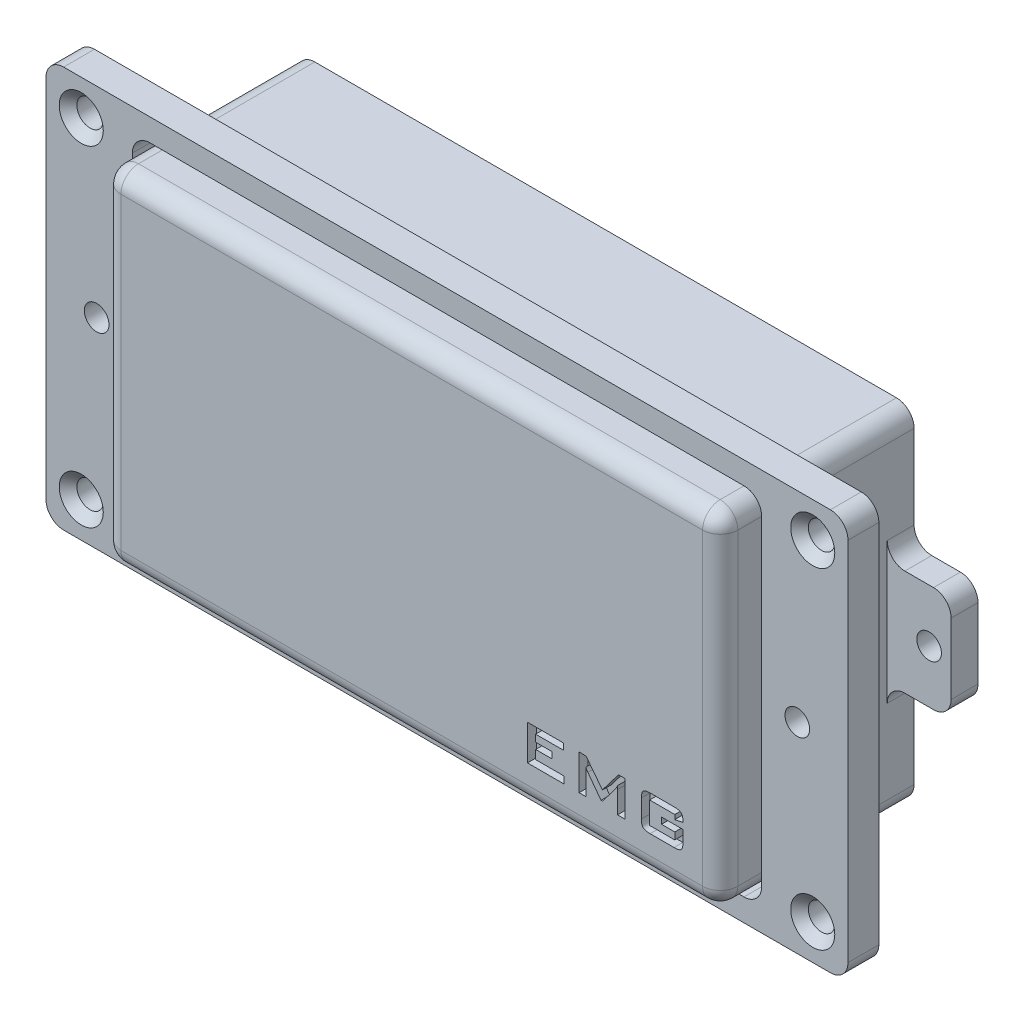
from build123d import *
from build123d.topology import SkipClean

# Parameters (mm, degrees)
SKETCH_1_W          = 70
SKETCH_1_H          = 39
EXTRUDE_1_DEPTH     = 22
SKETCH_2_R          = 1.4
EXTRUDE_2_DEPTH     = 3.05
SKETCH_3_W          = 91
SKETCH_3_H          = 45.5
EXTRUDE_3_DEPTH     = 7.5
SKETCH_4_W          = 91
SKETCH_4_H          = 45.5
SKETCH_4_W_2        = 71.4
SKETCH_4_H_2        = 40.4
CUT_EXTRUDE_1_DEPTH = 4
SKETCH_5_R          = 1.4
CUT_EXTRUDE_2_DEPTH = 64
SKETCH_6_R          = 1.5
CUT_EXTRUDE_3_DEPTH = 10
FILLET_1_R          = 2
FILLET_2_R          = 2
FILLET_3_R          = 2
CHAMFER_1_SIZE      = 1
CUT_EXTRUDE_4_DEPTH = 1
FILLET_4_R          = 2
SKETCH_8_W          = 66
SKETCH_8_H          = 35
CUT_EXTRUDE_5_DEPTH = 1
SKETCH_9_W          = 88
SKETCH_9_H          = 42.5
SKETCH_9_W_2        = 70.228427124
SKETCH_9_H_2        = 39.228427124
CUT_EXTRUDE_6_DEPTH = 1
SKETCH_11_R         = 2
SKETCH_11_R_2       = 1.5
EXTRUDE_4_DEPTH     = 1


with BuildPart() as part:
    # Эскиз1 → Бобышка-Вытянуть1 (new body)
    with BuildSketch(Plane.XY):
        Rectangle(SKETCH_1_W, SKETCH_1_H)
    extrude(amount=-EXTRUDE_1_DEPTH)

    # Эскиз2 → Бобышка-Вытянуть2 (add)
    # profile 1 of 2: a face of its own
    with BuildSketch(Plane(origin=(0, 0, -22), x_dir=(-1, 0, 0), z_dir=(0, 0, -1))):
        Polygon((35, -6), (42.25, -6), (42.25, 0), (42.25, 6), (35, 6), align=None)
        with Locations((39.75, 0)):
            Circle(SKETCH_2_R, mode=Mode.SUBTRACT)
    # profile 2 of 2: a face of its own
    with BuildSketch(Plane(origin=(0, 0, -22), x_dir=(-1, 0, 0), z_dir=(0, 0, -1))):
        Polygon((-42.25, -6), (-35, -6), (-35, 6), (-42.25, 6), (-42.25, 0), align=None)
        with Locations((-39.75, 0)):
            Circle(SKETCH_2_R, mode=Mode.SUBTRACT)
    extrude(amount=-EXTRUDE_2_DEPTH)

    # Скругление1
    fillet_1_edges = [part.edges().sort_by_distance(p)[0] for p in [
        (-35, 19.5, -11),
        (35, 19.5, -11),
        (35, -19.5, -11),
        (-35, -19.5, -11),
        (0, 19.5, 0),
        (-35, 0, 0),
        (0, -19.5, 0),
        (35, 0, 0),
    ]]
    fillet(fillet_1_edges, radius=FILLET_1_R)

    # Эскиз7 → Вырез-Вытянуть4 (cut)
    with BuildSketch(Plane.XY):
        with BuildLine():
            Line((29.843212459, -12.026020511), (26.986069602, -12.026020511))
            Line((26.986069602, -12.026020511), (26.986069602, -14.526020511))
            Line((26.986069602, -14.526020511), (29.843212459, -14.526020511))
            Line((29.843212459, -14.526020511), (29.843212459, -13.740306225))
            Line((29.843212459, -13.740306225), (28.343212459, -13.740306225))
            Line((28.343212459, -13.740306225), (28.343212459, -13.026020511))
            Line((28.343212459, -13.026020511), (30.771783887, -13.026020511))
            Line((30.771783887, -13.026020511), (30.771783887, -14.355261582))
            add(Edge.make_bspline(
                [(30.771783887, -14.355261582), (30.771227476, -14.399558746), (30.770155179, -14.484926644), (30.759662089, -14.607080409), (30.745100596, -14.718897677), (30.721395779, -14.818763608), (30.693021348, -14.908693368), (30.655960683, -14.986722173), (30.613764843, -15.054941156), (30.563438984, -15.112536845), (30.503071622, -15.160597677), (30.432084643, -15.201948964), (30.348647579, -15.236337652), (30.253371572, -15.263414337), (30.146428615, -15.286093807), (30.027350619, -15.301005213), (29.896172213, -15.309739351), (29.804908657, -15.311050474), (29.757274959, -15.311734796)],
                knots=[0, 0, 0, 0, 1.287740876, 2.481687819, 3.563317017, 4.56308199, 5.462791776, 6.299975377, 7.068275841, 7.7887847, 8.511887658, 9.302262014, 10.170193235, 11.128662927, 12.178892482, 13.346275316, 14.614926642, 16, 16, 16, 16], degree=3))
            Line((29.757274959, -15.311734796), (27.045221387, -15.311734796))
            add(Edge.make_bspline(
                [(27.045221387, -15.311734796), (26.998704073, -15.311048561), (26.909670878, -15.309735119), (26.781824103, -15.301050495), (26.665748161, -15.28596134), (26.561690144, -15.263637586), (26.469094566, -15.236176601), (26.387970739, -15.201699119), (26.318336978, -15.160614283), (26.259077522, -15.112494667), (26.209996158, -15.054830586), (26.168626804, -14.986921688), (26.134398761, -14.908302005), (26.106534189, -14.81877894), (26.08496672, -14.718619861), (26.06759993, -14.607280959), (26.059700032, -14.484840049), (26.058250555, -14.399538953), (26.057498173, -14.355261582)],
                knots=[0, 0, 0, 0, 1.370936796, 2.623945153, 3.774521602, 4.817517675, 5.757449821, 6.616944758, 7.408582044, 8.132975475, 8.856040047, 9.628928604, 10.468327203, 11.376846756, 12.387708688, 13.485566836, 14.694829334, 16, 16, 16, 16], degree=3))
            Line((26.057498173, -14.355261582), (26.057498173, -12.284949082))
            add(Edge.make_bspline(
                [(26.057498173, -12.284949082), (26.058222283, -12.239925192), (26.059606211, -12.153874996), (26.067792081, -12.029984646), (26.084801899, -11.917473846), (26.10677317, -11.815564534), (26.134168259, -11.72441908), (26.168653145, -11.644407594), (26.20998129, -11.575390161), (26.259029914, -11.516606508), (26.31825442, -11.467325889), (26.387891544, -11.425099113), (26.469037955, -11.389561683), (26.561491171, -11.360666063), (26.665770557, -11.338641262), (26.781869733, -11.323861651), (26.909614258, -11.313321868), (26.998694137, -11.312279326), (27.045221387, -11.311734796)],
                knots=[0, 0, 0, 0, 1.316875037, 2.516827271, 3.627751946, 4.641454711, 5.56374866, 6.406644186, 7.182863856, 7.908645129, 8.634426403, 9.425599436, 10.282837816, 11.218764033, 12.253729947, 13.395447964, 14.63961822, 16, 16, 16, 16], degree=3))
            Line((27.045221387, -11.311734796), (29.757274959, -11.311734796))
            add(Edge.make_bspline(
                [(29.757274959, -11.311734796), (29.804534309, -11.312431301), (29.895050146, -11.313765316), (30.024778745, -11.322307752), (30.142637617, -11.337730493), (30.249143439, -11.359639722), (30.343967244, -11.388566274), (30.427693624, -11.422497215), (30.498690832, -11.464351841), (30.560173451, -11.511898575), (30.610665065, -11.569375208), (30.655415997, -11.634813399), (30.690111758, -11.711985274), (30.720534115, -11.798095595), (30.743701137, -11.894988135), (30.759891356, -12.001758691), (30.770113514, -12.118829437), (30.771210934, -12.200105063), (30.771783887, -12.242538368)],
                knots=[0, 0, 0, 0, 1.397762872, 2.67713531, 3.842667912, 4.91085992, 5.888884288, 6.771660048, 7.57555246, 8.319614666, 9.059761586, 9.828787419, 10.655693125, 11.553495066, 12.527550264, 13.596648575, 14.745230877, 16, 16, 16, 16], degree=3))
            Line((30.771783887, -12.242538368), (30.771783887, -12.344100868))
            Line((30.771783887, -12.344100868), (29.843212459, -12.526020511))
            Line((29.843212459, -12.526020511), (29.843212459, -12.026020511))
        make_face()
        with BuildLine():
            Line((18.986069602, -15.311734796), (18.986069602, -11.311734796))
            Line((18.986069602, -11.311734796), (19.771783887, -11.311734796))
            Line((19.771783887, -11.311734796), (21.635623173, -13.716868725))
            Line((21.635623173, -13.716868725), (23.46151603, -11.311734796))
            Line((23.46151603, -11.311734796), (24.200355316, -11.311734796))
            Line((24.200355316, -11.311734796), (24.200355316, -15.311734796))
            Line((24.200355316, -15.311734796), (23.343212459, -15.311734796))
            Line((23.343212459, -15.311734796), (23.343212459, -12.831824082))
            add(Edge.make_bspline(
                [(23.343212459, -12.831824082), (23.343737796, -12.804657395), (23.344904826, -12.744306949), (23.352146817, -12.645307181), (23.363625116, -12.530815193), (23.37219349, -12.449380102), (23.376694602, -12.406600868)],
                knots=[0, 0, 0, 0, 0.764017789, 1.697255667, 2.790329359, 4, 4, 4, 4], degree=3))
            add(Edge.make_bspline(
                [(23.376694602, -12.406600868), (23.353664259, -12.454059717), (23.311808446, -12.540312391), (23.24923835, -12.655053385), (23.196782152, -12.748341947), (23.160865555, -12.801144163), (23.144551744, -12.825127654)],
                knots=[0, 0, 0, 0, 1.321116622, 2.401024161, 3.27372327, 4, 4, 4, 4], degree=3))
            Line((23.144551744, -12.825127654), (21.657944602, -14.811734796))
            Line((21.657944602, -14.811734796), (21.474908887, -14.811734796))
            Line((21.474908887, -14.811734796), (19.98495353, -12.817315154))
            add(Edge.make_bspline(
                [(19.98495353, -12.817315154), (19.959382552, -12.781049257), (19.910496808, -12.711717323), (19.844354752, -12.608743443), (19.792007033, -12.508791059), (19.762539352, -12.442833359), (19.748346387, -12.411065154)],
                knots=[0, 0, 0, 0, 1.130076345, 2.160442332, 3.113985983, 4, 4, 4, 4], degree=3))
            add(Edge.make_bspline(
                [(19.748346387, -12.411065154), (19.752390131, -12.450474292), (19.760087058, -12.525486287), (19.766105699, -12.633871273), (19.771438206, -12.734672977), (19.771670021, -12.799822884), (19.771783887, -12.831824082)],
                knots=[0, 0, 0, 0, 1.127408403, 2.145927464, 3.089291986, 4, 4, 4, 4], degree=3))
            Line((19.771783887, -12.831824082), (19.771783887, -15.311734796))
            Line((19.771783887, -15.311734796), (18.986069602, -15.311734796))
        make_face()
        Polygon((13.128926744, -15.311734796), (13.128926744, -11.311734796), (17.200355316, -11.311734796), (17.200355316, -12.026020511), (14.057498173, -12.026020511), (14.057498173, -12.811734796), (15.91464103, -12.811734796), (15.91464103, -13.526020511), (14.057498173, -13.526020511), (14.057498173, -14.526020511), (17.271783887, -14.526020511), (17.271783887, -15.311734796), align=None)
    extrude(amount=-CUT_EXTRUDE_4_DEPTH, mode=Mode.SUBTRACT)

    # Скругление4
    fillet_4_edges = [part.edges().sort_by_distance(p)[0] for p in [
        (-42.25, 6, -20.475),
        (-35, 6, -20.475),
        (-42.25, -6, -20.475),
        (-35, -6, -20.475),
        (35, -6, -20.475),
        (42.25, -6, -20.475),
        (35, 6, -20.475),
        (42.25, 6, -20.475),
    ]]
    fillet(fillet_4_edges, radius=FILLET_4_R)

    # Эскиз8 → Вырез-Вытянуть5 (cut)
    with BuildSketch(Plane(origin=(0, 0, -22), x_dir=(-1, 0, 0), z_dir=(0, 0, -1))):
        Rectangle(SKETCH_8_W, SKETCH_8_H)
    extrude(amount=-CUT_EXTRUDE_5_DEPTH, mode=Mode.SUBTRACT)


with BuildPart() as body_2:
    # Эскиз3 → Бобышка-Вытянуть3 (new body)
    with BuildSketch(Plane.XY):
        Rectangle(SKETCH_3_W, SKETCH_3_H)
        Polygon((-35.7, -20.2), (-35.7, 20.2), (35.7, 20.2), (35.7, 0), (35.7, -20.2), (0, -20.2), align=None, mode=Mode.SUBTRACT)
    extrude(amount=-EXTRUDE_3_DEPTH)

    # Эскиз4 → Вырез-Вытянуть1 (cut)
    with BuildSketch(Plane.XY):
        Rectangle(SKETCH_4_W, SKETCH_4_H)
        Rectangle(SKETCH_4_W_2, SKETCH_4_H_2, mode=Mode.SUBTRACT)
    extrude(amount=-CUT_EXTRUDE_1_DEPTH, mode=Mode.SUBTRACT)

    # Эскиз5 → Вырез-Вытянуть2 (cut)
    with BuildSketch(Plane(origin=(0, 0, -22), x_dir=(-1, 0, 0), z_dir=(0, 0, -1))):
        with Locations((-39.75, 0)):
            Circle(SKETCH_5_R)
        with Locations((39.75, 0)):
            Circle(SKETCH_5_R)
    extrude(amount=-CUT_EXTRUDE_2_DEPTH, mode=Mode.SUBTRACT)

    # Эскиз6 → Вырез-Вытянуть3 (cut)
    with BuildSketch(Plane.XY.offset(-4)):
        with BuildLine():
            ThreePointArc((41.5, -20.25), (42.973345481, -19.031519259), (42.053033504, -17.355670791))
            ThreePointArc((42.053033504, -17.355670791), (40.026654519, -18.468480741), (41.5, -20.25))
        make_face()
        with Locations((-41.5, -18.75)):
            Circle(SKETCH_6_R)
        with Locations((-41.5, 18.75)):
            Circle(SKETCH_6_R)
        with Locations((41.5, 18.75)):
            Circle(SKETCH_6_R)
    extrude(amount=-CUT_EXTRUDE_3_DEPTH, mode=Mode.SUBTRACT)

    # Скругление2
    fillet_2_edges = [body_2.edges().sort_by_distance(p)[0] for p in [
        (45.5, 22.75, -5.75),
        (-45.5, 22.75, -5.75),
        (-45.5, -22.75, -5.75),
        (45.5, -22.75, -5.75),
    ]]
    fillet(fillet_2_edges, radius=FILLET_2_R)

    # Скругление3
    fillet_3_edges = [body_2.edges().sort_by_distance(p)[0] for p in [
        (-35.7, 20.2, -5.75),
        (-35.7, -20.2, -5.75),
        (35.7, -20.2, -5.75),
        (35.7, 20.2, -5.75),
    ]]
    fillet(fillet_3_edges, radius=FILLET_3_R)

    # Фаска1
    chamfer_1_edges = [body_2.edges().sort_by_distance(p)[0] for p in [
        (-43, -18.75, -4),
        (-43, 18.75, -4),
        (40, 18.75, -4),
        (41.5, -17.25, -4),
    ]]
    chamfer(chamfer_1_edges, length=CHAMFER_1_SIZE)

    # Эскиз9 → Вырез-Вытянуть6 (cut)
    with BuildSketch(Plane(origin=(0, 0, -7.5), x_dir=(-1, 0, 0), z_dir=(0, 0, -1))):
        Rectangle(SKETCH_9_W, SKETCH_9_H)
        Rectangle(SKETCH_9_W_2, SKETCH_9_H_2, mode=Mode.SUBTRACT)
    extrude(amount=-CUT_EXTRUDE_6_DEPTH, mode=Mode.SUBTRACT)

    # Эскиз11 → Бобышка-Вытянуть4 (add)
    # profile 1 of 4: a face of its own
    with SkipClean():  # the faces are left unmerged after this step: merging them gives an invalid solid
        with BuildSketch(Plane(origin=(0, 0, -6.5), x_dir=(-1, 0, 0), z_dir=(0, 0, -1))):
            with Locations((-41.5, 18.75)):
                Circle(SKETCH_11_R)
            with Locations((-41.5, 18.75)):
                Circle(SKETCH_11_R_2, mode=Mode.SUBTRACT)
        # profile 2 of 4: a face of its own
        with BuildSketch(Plane(origin=(0, 0, -6.5), x_dir=(-1, 0, 0), z_dir=(0, 0, -1))):
            with Locations((-41.5, -18.75)):
                Circle(SKETCH_11_R)
            with Locations((-41.5, -18.75)):
                Circle(SKETCH_11_R_2, mode=Mode.SUBTRACT)
        # profile 3 of 4: a face of its own
        with BuildSketch(Plane(origin=(0, 0, -6.5), x_dir=(-1, 0, 0), z_dir=(0, 0, -1))):
            with Locations((41.5, -18.75)):
                Circle(SKETCH_11_R)
            with Locations((41.5, -18.75)):
                Circle(SKETCH_11_R_2, mode=Mode.SUBTRACT)
        # profile 4 of 4: a face of its own
        with BuildSketch(Plane(origin=(0, 0, -6.5), x_dir=(-1, 0, 0), z_dir=(0, 0, -1))):
            with Locations((41.5, 18.75)):
                Circle(SKETCH_11_R)
            with Locations((41.5, 18.75)):
                Circle(SKETCH_11_R_2, mode=Mode.SUBTRACT)
        extrude(amount=EXTRUDE_4_DEPTH)


solid = Compound([part.part, body_2.part])
